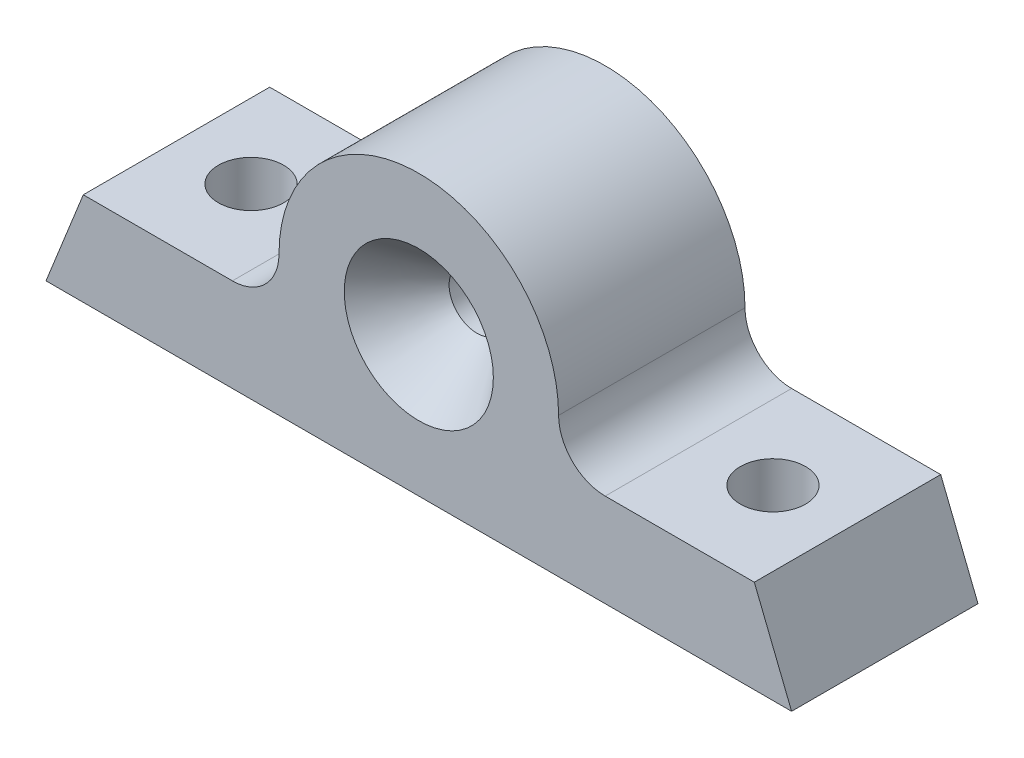
from build123d import *

# Parameters (mm, degrees)
SKETCH1_R           = 1.5
BOSS_EXTRUDE1_DEPTH = 10
SKETCH3_R           = 1.75
CUT_EXTRUDE1_DEPTH  = 25.494897428


with BuildPart() as part:
    # Sketch1 → Boss-Extrude1 (new body)
    with BuildSketch(Plane.XY):
        with BuildLine():
            Line((-10, -2.5), (-18, -2.5))
            Line((-18, -2.5), (-20, -7.5))
            Line((-20, -7.5), (20, -7.5))
            Line((20, -7.5), (18, -2.5))
            Line((18, -2.5), (10, -2.5))
            ThreePointArc((10, -2.5), (8.232233047, -1.767766953), (7.5, 0))
            ThreePointArc((7.5, 0), (0, 7.5), (-7.5, 0))
            ThreePointArc((-7.5, 0), (-8.232233047, -1.767766953), (-10, -2.5))
        make_face()
        Circle(SKETCH1_R, mode=Mode.SUBTRACT)
    extrude(amount=BOSS_EXTRUDE1_DEPTH)

    # Sketch2 → Cut-Revolve1 (revolve, cut)
    with BuildSketch(Plane(origin=(0, 0, 0), x_dir=(1, 0, 0), z_dir=(0, 1, 0))):
        Polygon((0, 0), (0, -10), (4, -10), (1.5, -6.875), (1.5, -5), (2.5, -5), (2.5, 0), align=None)
    revolve(axis=Axis((0, 0, 10), (0, 0, -1)), mode=Mode.SUBTRACT)

    # Sketch3 → Cut-Extrude1 (cut, through all)
    with BuildSketch(Plane(origin=(0, -2.5, 0), x_dir=(1, 0, 0), z_dir=(0, 1, 0))):
        with Locations((-14, -5)):
            Circle(SKETCH3_R)
        with Locations((14, -5)):
            Circle(SKETCH3_R)
    extrude(amount=-CUT_EXTRUDE1_DEPTH, mode=Mode.SUBTRACT)


solid = part.part
